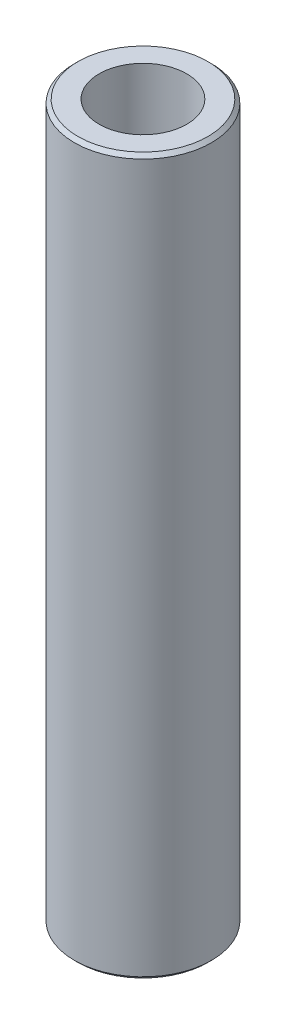
from build123d import *

# Parameters (mm, degrees)
SKETCH1_R           = 57.5
BOSS_EXTRUDE1_DEPTH = 600
SKETCH2_R           = 36.7354089
CUT_EXTRUDE1_DEPTH  = 606.485342515
CHAMFER1_SIZE       = 3.010290584


with BuildPart() as part:
    # Sketch1 → Boss-Extrude1 (new body)
    with BuildSketch(Plane(origin=(0, 0, 0), x_dir=(1, 0, 0), z_dir=(0, 1, 0))):
        Circle(SKETCH1_R)
    extrude(amount=BOSS_EXTRUDE1_DEPTH)

    # Sketch2 → Cut-Extrude1 (cut, through all)
    with BuildSketch(Plane(origin=(0, 0, 0), x_dir=(1, 0, 0), z_dir=(0, 1, 0))):
        Circle(SKETCH2_R)
    extrude(amount=CUT_EXTRUDE1_DEPTH, mode=Mode.SUBTRACT)

    # Chamfer1
    chamfer1_edges = [part.edges().sort_by_distance(p)[0] for p in [
        (-57.5, 600, 0),
        (-57.5, 0, 0),
    ]]
    chamfer(chamfer1_edges, length=CHAMFER1_SIZE)


solid = part.part
